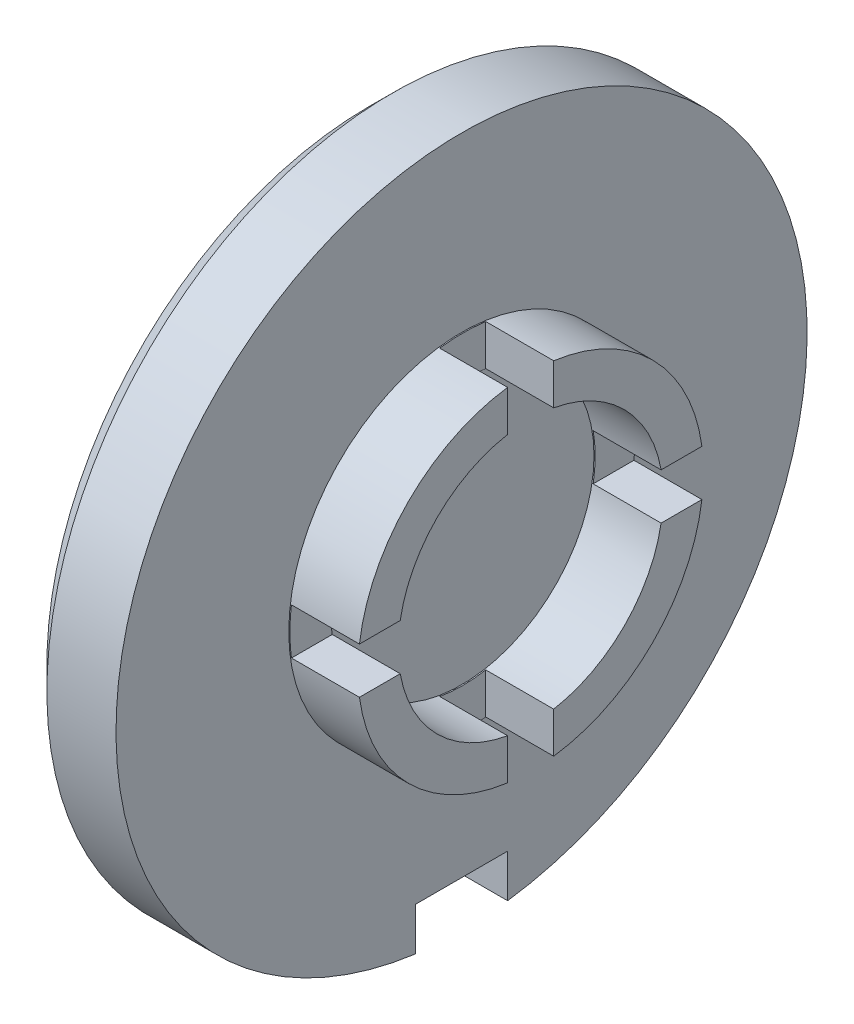
from build123d import *

# Parameters (mm, degrees)
BOSS_EXTRUDE1_START = -55.2
SKETCH2_W           = 1.28
SKETCH2_H           = 0.8
BOSS_EXTRUDE1_DEPTH = 6.4
BOSS_EXTRUDE2_START = -52.4
SKETCH3_W           = 1.28
SKETCH3_H           = 6.4
BOSS_EXTRUDE2_DEPTH = 0.8
BOSS_EXTRUDE3_START = -52.8
SKETCH4_W           = 1.8
SKETCH4_H           = 0.9
BOSS_EXTRUDE3_DEPTH = 1.6


with BuildPart() as part:
    # Sketch1 → Revolve1 (revolve)
    with BuildSketch(Plane.XY.offset(-52)):
        Polygon((-58.2, 20.3), (-59.4, 20.3), (-59.4, 18), (-61, 18), (-61, 23.6), (-60.6, 24), (-59.4, 24), (-59.4, 21), (-58.2, 21), align=None)
    revolve(axis=Axis((-66, 18, -52), (1, 0, 0)))


with BuildPart() as body_2:
    # Sketch2 → Boss-Extrude1 (new body)
    with BuildSketch(Plane.XY.offset(BOSS_EXTRUDE1_START)):
        with Locations((-58.74, 18)):
            Rectangle(SKETCH2_W, SKETCH2_H)
    extrude(amount=BOSS_EXTRUDE1_DEPTH)


with BuildPart() as part_1:
    add(part.part)

    # Combine1: cut body 2
    add(body_2.part, mode=Mode.SUBTRACT)


with BuildPart() as body_2_2:
    # Sketch3 → Boss-Extrude2 (new body)
    with BuildSketch(Plane.XY.offset(BOSS_EXTRUDE2_START)):
        with Locations((-58.74, 18)):
            Rectangle(SKETCH3_W, SKETCH3_H)
    extrude(amount=BOSS_EXTRUDE2_DEPTH)


with BuildPart() as part_2:
    add(part_1.part)

    # Combine2: cut body 2 2
    add(body_2_2.part, mode=Mode.SUBTRACT)


with BuildPart() as body_2_3:
    # Sketch4 → Boss-Extrude3 (new body)
    with BuildSketch(Plane.XY.offset(BOSS_EXTRUDE3_START)):
        with Locations((-60.2, 12.35)):
            Rectangle(SKETCH4_W, SKETCH4_H)
    extrude(amount=BOSS_EXTRUDE3_DEPTH)


with BuildPart() as part_3:
    add(part_2.part)

    # Combine3: cut body 2 3
    add(body_2_3.part, mode=Mode.SUBTRACT)


solid = part_3.part
